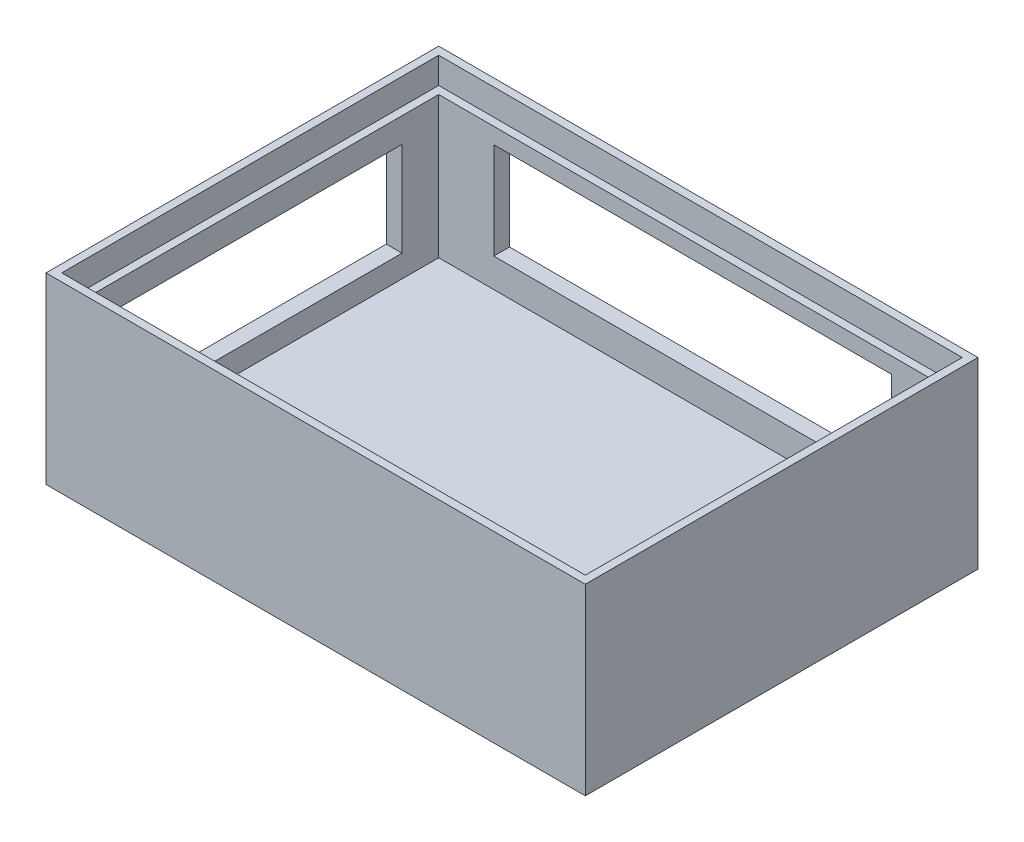
from build123d import *

# Parameters (mm, degrees)
ESQUISSE1_W              = 103
ESQUISSE1_H              = 75
BOSS_EXTRU_1_DEPTH       = 35
COQUE2_T                 = -3
ESQUISSE3_W              = 55
ESQUISSE3_H              = 18
ENL_V_MAT_EXTRU_7_DEPTH  = 31
ESQUISSE10_W             = 75.964874154
ESQUISSE10_H             = 18.415602026
ENL_V_MAT_EXTRU_9_DEPTH  = 10
ESQUISSE11_W             = 100
ESQUISSE11_H             = 72
ENL_V_MAT_EXTRU_12_DEPTH = 5


with BuildPart() as part:
    # Esquisse1 → Boss.-Extru.1 (new body)
    with BuildSketch(Plane(origin=(0, 0, 0), x_dir=(1, 0, 0), z_dir=(0, 1, 0))):
        with Locations((51.5, 37.5)):
            Rectangle(ESQUISSE1_W, ESQUISSE1_H)
    extrude(amount=BOSS_EXTRU_1_DEPTH)

    # Coque2
    coque2_openings = [part.faces().sort_by_distance(p)[0] for p in [
        (51.5, 35, -37.5),
    ]]
    offset(amount=COQUE2_T, openings=coque2_openings, kind=Kind.INTERSECTION)

    # Esquisse3 → Enlèv. mat.-Extru.7 (cut)
    with BuildSketch(Plane(origin=(0, 0, 0), x_dir=(0, 0, -1), z_dir=(1, 0, 0))):
        with Locations((37.5, 16.259058204)):
            Rectangle(ESQUISSE3_W, ESQUISSE3_H)
    extrude(amount=ENL_V_MAT_EXTRU_7_DEPTH, mode=Mode.SUBTRACT)

    # Esquisse10 → Enlèv. mat.-Extru.9 (cut)
    with BuildSketch(Plane(origin=(0, 0, -75), x_dir=(-1, 0, 0), z_dir=(0, 0, -1))):
        with Locations((-51.5, 17.75)):
            Rectangle(ESQUISSE10_W, ESQUISSE10_H)
    extrude(amount=-ENL_V_MAT_EXTRU_9_DEPTH, mode=Mode.SUBTRACT)

    # Esquisse11 → Enlèv. mat.-Extru.12 (cut)
    with BuildSketch(Plane(origin=(0, 35, 0), x_dir=(1, 0, 0), z_dir=(0, 1, 0))):
        with Locations((51.5, 37.5)):
            Rectangle(ESQUISSE11_W, ESQUISSE11_H)
    extrude(amount=-ENL_V_MAT_EXTRU_12_DEPTH, mode=Mode.SUBTRACT)


solid = part.part
